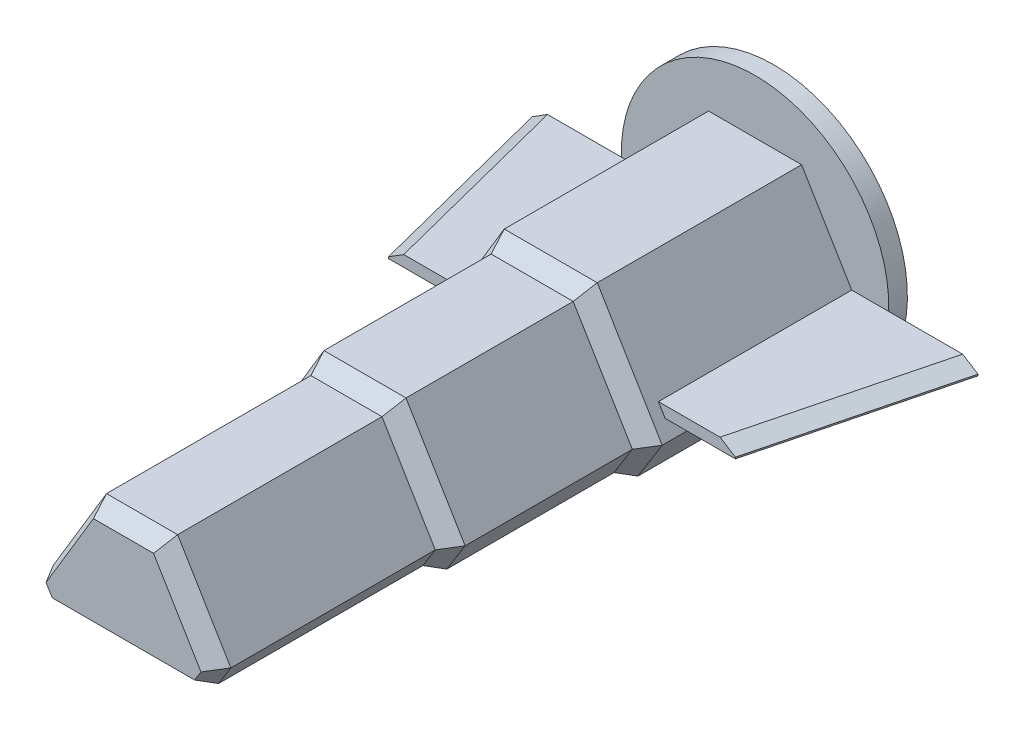
from build123d import *
from OCP.BRepFilletAPI import BRepFilletAPI_MakeChamfer

# Parameters (mm, degrees)
BOSS_EXTRUDE1_DEPTH      = 60
BOSS_EXTRUDE2_DEPTH      = 50
BOSS_EXTRUDE2_DEPTH_BACK = 3
CHAMFER1_SIZE            = 5
CHAMFER1_SIZE_2          = 2.6
BOSS_EXTRUDE3_DEPTH      = 60
BOSS_EXTRUDE3_DEPTH_BACK = 8
CHAMFER2_SIZE            = 2.6
CHAMFER2_SIZE_2          = 5
BOSS_EXTRUDE4_REACH      = 145.499
SKETCH9_W                = 52
SKETCH9_H                = 3
CUT_EXTRUDE1_DEPTH       = 28
CHAMFER3_SIZE            = 2.6
CHAMFER3_SIZE_2          = 5
BOSS_EXTRUDE5_DEPTH      = 5
BOSS_EXTRUDE6_REACH      = 165.988
SKETCH13_W               = 52
SKETCH13_H               = 3
CUT_EXTRUDE2_DEPTH       = 5
CHAMFER4_SIZE            = 4
CHAMFER4_SIZE2           = 2.6
CHAMFER5_SIZE            = 2.6
CHAMFER5_SIZE2           = 4
SKETCH16_R               = 36
BOSS_EXTRUDE7_DEPTH      = 5


with BuildPart() as part:
    # Sketch1 → Boss-Extrude1 (new body)
    with BuildSketch(Plane.XY):
        Polygon((23.485714286, -19.8), (-23.485714286, -19.8), (-30, -9.342857143), (-12.514285714, 19.8), (12.514285714, 19.8), (30, -9.342857143), align=None)
        Polygon((-26.95263288, -9.317403585), (-11.042190729, 17.2), (11.042190729, 17.2), (26.95263288, -9.317403585), (22.042162982, -17.2), (-22.042162982, -17.2), align=None, mode=Mode.SUBTRACT)
    extrude(amount=-BOSS_EXTRUDE1_DEPTH)

    # Chamfer1
    chamfer1_edges_1 = [part.edges().sort_by_distance(p)[0] for p in [
        (26.742857143, -14.571428571, 0),
    ]]
    chamfer1_side_1 = [part.faces().sort_by_distance(p)[0] for p in [
        (26.742857143, -14.571428571, -0.052),
    ]]
    chamfer1_edges_2 = [part.edges().sort_by_distance(p)[0] for p in [
        (0, -19.8, 0),
    ]]
    chamfer1_side_2 = [part.faces().sort_by_distance(p)[0] for p in [
        (0, -19.8, -0.052),
    ]]
    chamfer1_edges_3 = [part.edges().sort_by_distance(p)[0] for p in [
        (-26.742857143, -14.571428571, 0),
    ]]
    chamfer1_side_3 = [part.faces().sort_by_distance(p)[0] for p in [
        (-26.742857143, -14.571428571, -0.052),
    ]]
    chamfer1_edges_4 = [part.edges().sort_by_distance(p)[0] for p in [
        (-21.257142857, 5.228571429, 0),
    ]]
    chamfer1_side_4 = [part.faces().sort_by_distance(p)[0] for p in [
        (-21.257142857, 5.228571429, -0.052),
    ]]
    chamfer1_edges_5 = [part.edges().sort_by_distance(p)[0] for p in [
        (0, 19.8, 0),
    ]]
    chamfer1_side_5 = [part.faces().sort_by_distance(p)[0] for p in [
        (0, 19.8, -0.052),
    ]]
    chamfer1_edges_6 = [part.edges().sort_by_distance(p)[0] for p in [
        (21.257142857, 5.228571429, 0),
    ]]
    chamfer1_side_6 = [part.faces().sort_by_distance(p)[0] for p in [
        (21.257142857, 5.228571429, -0.052),
    ]]
    chamfer1 = BRepFilletAPI_MakeChamfer(part.part.solid().wrapped)
    for e in chamfer1_edges_1:
        chamfer1.Add(CHAMFER1_SIZE - 0.0001, CHAMFER1_SIZE_2 - 0.0001, e.wrapped, chamfer1_side_1[0].wrapped)
    for e in chamfer1_edges_2:
        chamfer1.Add(CHAMFER1_SIZE - 0.0001, CHAMFER1_SIZE_2 - 0.0001, e.wrapped, chamfer1_side_2[0].wrapped)
    for e in chamfer1_edges_3:
        chamfer1.Add(CHAMFER1_SIZE - 0.0001, CHAMFER1_SIZE_2 - 0.0001, e.wrapped, chamfer1_side_3[0].wrapped)
    for e in chamfer1_edges_4:
        chamfer1.Add(CHAMFER1_SIZE - 0.0001, CHAMFER1_SIZE_2 - 0.0001, e.wrapped, chamfer1_side_4[0].wrapped)
    for e in chamfer1_edges_5:
        chamfer1.Add(CHAMFER1_SIZE - 0.0001, CHAMFER1_SIZE_2 - 0.0001, e.wrapped, chamfer1_side_5[0].wrapped)
    for e in chamfer1_edges_6:
        chamfer1.Add(CHAMFER1_SIZE - 0.0001, CHAMFER1_SIZE_2 - 0.0001, e.wrapped, chamfer1_side_6[0].wrapped)
    add(Compound.cast(chamfer1.Shape()), mode=Mode.REPLACE)  # a hair under: the kernel refuses the full size

    # Boss-Extrude4: up to this plane
    boss_extrude4_end = Plane(origin=(12.514285714, 19.8, -60), z_dir=(0.8574929257125442, 0.5144957554275265, 0))
    # Sketch9 → Boss-Extrude4 (add, up to the surface)
    with BuildSketch(Plane(origin=(60, 0, 0), x_dir=(0, 0, -1), z_dir=(1, 0, 0)), mode=Mode.PRIVATE) as boss_extrude4_sk1:
        with Locations((34, -4.177515253)):
            Rectangle(SKETCH9_W, SKETCH9_H)
    boss_extrude4_tool1 = split(extrude(boss_extrude4_sk1.sketch, amount=-BOSS_EXTRUDE4_REACH, mode=Mode.PRIVATE), bisect_by=boss_extrude4_end, keep=Keep.BOTH, mode=Mode.PRIVATE)
    add(boss_extrude4_tool1.solids().sort_by_distance((60, -4.177515, -34))[0])

    # Sketch10 → Cut-Extrude1 (cut)
    with BuildSketch(Plane(origin=(0, -2.677515253, 0), x_dir=(1, 0, 0), z_dir=(0, 1, 0))):
        Polygon((60, 8), (60, 60), (46.7, 8), align=None)
    extrude(amount=-CUT_EXTRUDE1_DEPTH, mode=Mode.SUBTRACT)

    # Boss-Extrude6: up to this plane
    boss_extrude6_end = Plane(origin=(-30, -9.342857143, -60), z_dir=(-0.8574929257125442, 0.5144957554275265, 0))
    # Sketch13 → Boss-Extrude6 (add, up to the surface)
    with BuildSketch(Plane(origin=(-60, 0, 0), x_dir=(0, 0, -1), z_dir=(1, 0, 0)), mode=Mode.PRIVATE) as boss_extrude6_sk1:
        with Locations((34, -4.177515253)):
            Rectangle(SKETCH13_W, SKETCH13_H)
    boss_extrude6_tool1 = split(extrude(boss_extrude6_sk1.sketch, amount=BOSS_EXTRUDE6_REACH, mode=Mode.PRIVATE), bisect_by=boss_extrude6_end, keep=Keep.BOTH, mode=Mode.PRIVATE)
    add(boss_extrude6_tool1.solids().sort_by_distance((-60, -4.177515, -34))[0])

    # Sketch14 → Cut-Extrude2 (cut)
    with BuildSketch(Plane(origin=(0, -2.677515253, 0), x_dir=(1, 0, 0), z_dir=(0, 1, 0))):
        Polygon((-60, 60), (-60, 8), (-46.7, 8), align=None)
    extrude(amount=-CUT_EXTRUDE2_DEPTH, mode=Mode.SUBTRACT)

    # Chamfer4
    chamfer4_edges = [part.edges().sort_by_distance(p)[0] for p in [
        (-53.35, -2.677515253, -34),
    ]]
    chamfer4_side = [part.faces().sort_by_distance(p)[0] for p in [
        (-39.944890335, -2.677515253, -36.10731292),
    ]]
    chamfer(chamfer4_edges, length=CHAMFER4_SIZE, length2=CHAMFER4_SIZE2, reference=chamfer4_side[0])

    # Chamfer5
    chamfer5_edges = [part.edges().sort_by_distance(p)[0] for p in [
        (53.35, -2.677515253, -34),
    ]]
    chamfer5_side = [part.faces().sort_by_distance(p)[0] for p in [
        (53.35, -4.177515253, -34),
    ]]
    chamfer(chamfer5_edges, length=CHAMFER5_SIZE, length2=CHAMFER5_SIZE2, reference=chamfer5_side[0])

    # Sketch16 → Boss-Extrude7 (add)
    with BuildSketch(Plane(origin=(0, 0, -60), x_dir=(-1, 0, 0), z_dir=(0, 0, -1))):
        with Locations(Location((0, -1.629183352, 0), (0, 0, 181.66870794))):
            Circle(SKETCH16_R)
    extrude(amount=BOSS_EXTRUDE7_DEPTH)


with BuildPart() as body_2:
    # Sketch2 → Boss-Extrude2 (new, two sides: drawn at the far end of the back side and taken through both)
    with BuildSketch(Plane.XY.offset(-BOSS_EXTRUDE2_DEPTH_BACK)):
        Polygon((26.95263288, -9.317403585), (11.042190729, 17.2), (-11.042190729, 17.2), (-26.95263288, -9.317403585), (-22.042162982, -17.2), (22.042162982, -17.2), align=None)
        Polygon((23.90526576, -9.291950027), (9.570095744, 14.6), (-9.570095744, 14.6), (-23.90526576, -9.291950027), (-20.598611678, -14.6), (20.598611678, -14.6), align=None, mode=Mode.SUBTRACT)
    extrude(amount=BOSS_EXTRUDE2_DEPTH + BOSS_EXTRUDE2_DEPTH_BACK)

    # Chamfer2
    chamfer2_edges_1 = [body_2.edges().sort_by_distance(p)[0] for p in [
        (24.497397931, -13.258701792, 50),
    ]]
    chamfer2_side_1 = [body_2.faces().sort_by_distance(p)[0] for p in [
        (24.453261418, -13.231206916, 50),
    ]]
    chamfer2_edges_2 = [body_2.edges().sort_by_distance(p)[0] for p in [
        (18.997411804, 3.941298208, 50),
    ]]
    chamfer2_side_2 = [body_2.faces().sort_by_distance(p)[0] for p in [
        (18.997411804, 3.941298208, 49.948),
    ]]
    chamfer2_edges_3 = [body_2.edges().sort_by_distance(p)[0] for p in [
        (0, 17.2, 50),
    ]]
    chamfer2_side_3 = [body_2.faces().sort_by_distance(p)[0] for p in [
        (0, 17.2, 49.948),
    ]]
    chamfer2_edges_4 = [body_2.edges().sort_by_distance(p)[0] for p in [
        (-18.997411804, 3.941298208, 50),
    ]]
    chamfer2_side_4 = [body_2.faces().sort_by_distance(p)[0] for p in [
        (-18.997411804, 3.941298208, 49.948),
    ]]
    chamfer2_edges_5 = [body_2.edges().sort_by_distance(p)[0] for p in [
        (-24.497397931, -13.258701792, 50),
    ]]
    chamfer2_side_5 = [body_2.faces().sort_by_distance(p)[0] for p in [
        (-24.497397931, -13.258701792, 49.948),
    ]]
    chamfer2_edges_6 = [body_2.edges().sort_by_distance(p)[0] for p in [
        (0, -17.2, 50),
    ]]
    chamfer2_side_6 = [body_2.faces().sort_by_distance(p)[0] for p in [
        (0, -17.2, 49.948),
    ]]
    chamfer2 = BRepFilletAPI_MakeChamfer(body_2.part.solid().wrapped)
    for e in chamfer2_edges_1:
        chamfer2.Add(CHAMFER2_SIZE - 0.0001, CHAMFER2_SIZE_2 - 0.0001, e.wrapped, chamfer2_side_1[0].wrapped)
    for e in chamfer2_edges_2:
        chamfer2.Add(CHAMFER2_SIZE_2 - 0.0001, CHAMFER2_SIZE - 0.0001, e.wrapped, chamfer2_side_2[0].wrapped)
    for e in chamfer2_edges_3:
        chamfer2.Add(CHAMFER2_SIZE_2 - 0.0001, CHAMFER2_SIZE - 0.0001, e.wrapped, chamfer2_side_3[0].wrapped)
    for e in chamfer2_edges_4:
        chamfer2.Add(CHAMFER2_SIZE_2 - 0.0001, CHAMFER2_SIZE - 0.0001, e.wrapped, chamfer2_side_4[0].wrapped)
    for e in chamfer2_edges_5:
        chamfer2.Add(CHAMFER2_SIZE_2 - 0.0001, CHAMFER2_SIZE - 0.0001, e.wrapped, chamfer2_side_5[0].wrapped)
    for e in chamfer2_edges_6:
        chamfer2.Add(CHAMFER2_SIZE_2 - 0.0001, CHAMFER2_SIZE - 0.0001, e.wrapped, chamfer2_side_6[0].wrapped)
    add(Compound.cast(chamfer2.Shape()), mode=Mode.REPLACE)  # a hair under: the kernel refuses the full size


with BuildPart() as body_3:
    # Sketch8 → Boss-Extrude3 (new, two sides: drawn at the far end of the back side and taken through both)
    with BuildSketch(Plane.XY.offset(50).offset(-BOSS_EXTRUDE3_DEPTH_BACK)):
        Polygon((23.90526576, -9.291950027), (9.570095744, 14.6), (-9.570095744, 14.6), (-23.90526576, -9.291950027), (-20.598611678, -14.6), (20.598611678, -14.6), align=None)
        Polygon((19.155060374, -12), (20.85789864, -9.266496469), (8.098000758, 12), (-8.098000758, 12), (-20.85789864, -9.266496469), (-19.155060374, -12), align=None, mode=Mode.SUBTRACT)
    extrude(amount=BOSS_EXTRUDE3_DEPTH + BOSS_EXTRUDE3_DEPTH_BACK)

    # Chamfer3
    chamfer3_edges_1 = [body_3.edges().sort_by_distance(p)[0] for p in [
        (22.251938719, -11.945975013, 110),
    ]]
    chamfer3_side_1 = [body_3.faces().sort_by_distance(p)[0] for p in [
        (22.207802206, -11.918480137, 110),
    ]]
    chamfer3_edges_2 = [body_3.edges().sort_by_distance(p)[0] for p in [
        (16.737680752, 2.654024987, 110),
    ]]
    chamfer3_side_2 = [body_3.faces().sort_by_distance(p)[0] for p in [
        (16.737680752, 2.654024987, 109.948),
    ]]
    chamfer3_edges_3 = [body_3.edges().sort_by_distance(p)[0] for p in [
        (0, 14.6, 110),
    ]]
    chamfer3_side_3 = [body_3.faces().sort_by_distance(p)[0] for p in [
        (0, 14.6, 109.948),
    ]]
    chamfer3_edges_4 = [body_3.edges().sort_by_distance(p)[0] for p in [
        (-16.737680752, 2.654024987, 110),
    ]]
    chamfer3_side_4 = [body_3.faces().sort_by_distance(p)[0] for p in [
        (-16.737680752, 2.654024987, 109.948),
    ]]
    chamfer3_edges_5 = [body_3.edges().sort_by_distance(p)[0] for p in [
        (-22.251938719, -11.945975013, 110),
    ]]
    chamfer3_side_5 = [body_3.faces().sort_by_distance(p)[0] for p in [
        (-22.251938719, -11.945975013, 109.948),
    ]]
    chamfer3_edges_6 = [body_3.edges().sort_by_distance(p)[0] for p in [
        (0, -14.6, 110),
    ]]
    chamfer3_side_6 = [body_3.faces().sort_by_distance(p)[0] for p in [
        (0, -14.6, 109.948),
    ]]
    chamfer3 = BRepFilletAPI_MakeChamfer(body_3.part.solid().wrapped)
    for e in chamfer3_edges_1:
        chamfer3.Add(CHAMFER3_SIZE - 0.0001, CHAMFER3_SIZE_2 - 0.0001, e.wrapped, chamfer3_side_1[0].wrapped)
    for e in chamfer3_edges_2:
        chamfer3.Add(CHAMFER3_SIZE_2 - 0.0001, CHAMFER3_SIZE - 0.0001, e.wrapped, chamfer3_side_2[0].wrapped)
    for e in chamfer3_edges_3:
        chamfer3.Add(CHAMFER3_SIZE_2 - 0.0001, CHAMFER3_SIZE - 0.0001, e.wrapped, chamfer3_side_3[0].wrapped)
    for e in chamfer3_edges_4:
        chamfer3.Add(CHAMFER3_SIZE_2 - 0.0001, CHAMFER3_SIZE - 0.0001, e.wrapped, chamfer3_side_4[0].wrapped)
    for e in chamfer3_edges_5:
        chamfer3.Add(CHAMFER3_SIZE_2 - 0.0001, CHAMFER3_SIZE - 0.0001, e.wrapped, chamfer3_side_5[0].wrapped)
    for e in chamfer3_edges_6:
        chamfer3.Add(CHAMFER3_SIZE_2 - 0.0001, CHAMFER3_SIZE - 0.0001, e.wrapped, chamfer3_side_6[0].wrapped)
    add(Compound.cast(chamfer3.Shape()), mode=Mode.REPLACE)  # a hair under: the kernel refuses the full size

    # Sketch12 → Boss-Extrude5 (add)
    with BuildSketch(Plane.XY.offset(110)):
        Polygon((-20.85789864, -9.266496469), (-19.155060374, -12), (19.155060374, -12), (20.85789864, -9.266496469), (8.098000758, 12), (-8.098000758, 12), align=None)
    extrude(amount=-BOSS_EXTRUDE5_DEPTH)


solid = Compound([part.part, body_2.part, body_3.part])
